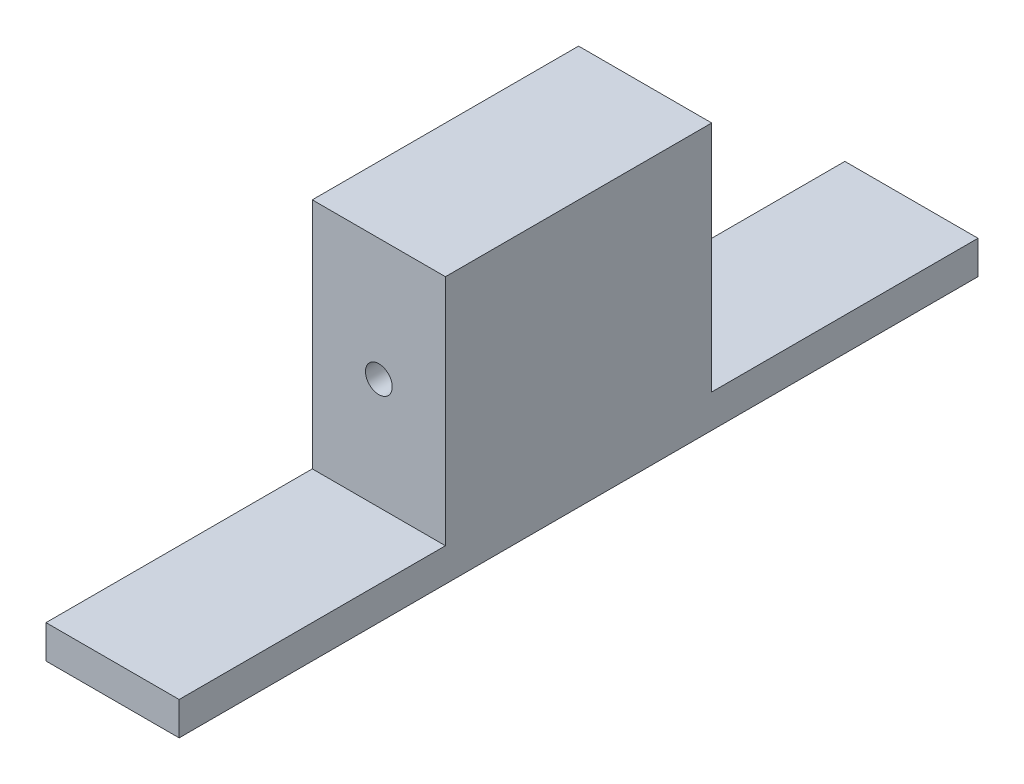
from build123d import *

# Parameters (mm, degrees)
BOSS_EXTRUDE1_DEPTH         = 25.4
F_1_4_20_TAPPED_HOLE1_D     = 5.1054
F_1_4_20_TAPPED_HOLE1_DEPTH = 25.4
F_1_4_20_TAPPED_HOLE1_TIP   = 1.533816902


with BuildPart() as part:
    # Sketch-Profile → Boss-Extrude1 (new body)
    with BuildSketch(Plane(origin=(0, 0, 0), x_dir=(0, 0, -1), z_dir=(1, 0, 0))):
        Polygon((-76.2, 6.35), (-76.2, 0), (76.2, 0), (76.2, 6.35), (25.4, 6.35), (25.4, 50.8), (-25.4, 50.8), (-25.4, 6.35), align=None)
    extrude(amount=BOSS_EXTRUDE1_DEPTH)

    # 1/4-20 Tapped Hole1
    with Locations(Plane.XY.offset(25.4)):
        with Locations((12.7, 27.5181)):
            Hole(F_1_4_20_TAPPED_HOLE1_D / 2, depth=F_1_4_20_TAPPED_HOLE1_DEPTH)
            with Locations((0, 0, -(F_1_4_20_TAPPED_HOLE1_DEPTH + F_1_4_20_TAPPED_HOLE1_TIP / 2))):  # 118° drill point
                Cone(0, F_1_4_20_TAPPED_HOLE1_D / 2, F_1_4_20_TAPPED_HOLE1_TIP, mode=Mode.SUBTRACT)


solid = part.part
